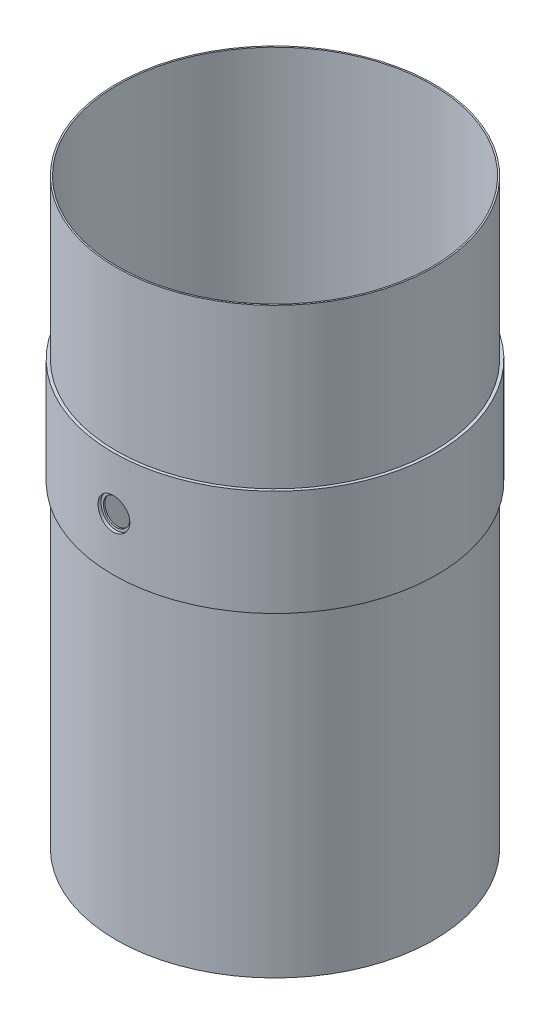
from build123d import *

# Parameters (mm, degrees)
BOSS_EXTRUDE1_DEPTH                  = 127
BOSS_EXTRUDE1_DEPTH_BACK             = 152.4
SKETCH1_R                            = 76.2
SKETCH1_R_2                          = 75.4888
SKETCH2_R                            = 77.6224
SKETCH2_R_2                          = 76.2
BOSS_EXTRUDE2_DEPTH                  = 50.8
F_1_2_0_5_DIAMETER_HOLE2_REACH       = 232.98
F_1_2_0_5_DIAMETER_HOLE2_BORE_R      = 6.35
F_1_2_START                          = 75.818042607
F_1_2_0_6_DIAMETER_HOLE1_OUTLINE_R   = 7.62
F_1_2_0_6_DIAMETER_HOLE1_OUTLINE_R_2 = 6.35
F_1_2_0_6_DIAMETER_HOLE1_DEPTH       = 3.181957393
F_1_2_START_2                        = 17
F_1_2_0_6_DIAMETER_HOLE1_2_DEPTH     = 17
F_1_2_START_3                        = 75.818042657
F_1_2_0_6_DIAMETER_HOLE1_3_OUTLINE_R = 6.35
F_1_2_0_6_DIAMETER_HOLE1_3_DEPTH     = 1.181957343


with BuildPart() as part:
    # Sketch1 → Boss-Extrude1 (new, two sides: drawn at the far end of the back side and taken through both)
    with BuildSketch(Plane(origin=(0, 0, 0), x_dir=(1, 0, 0), z_dir=(0, 1, 0)).offset(-BOSS_EXTRUDE1_DEPTH_BACK)):
        with Locations(Location((0, 0, 0), (0, 0, 270))):
            Circle(SKETCH1_R)
        with Locations(Location((0, 0, 0), (0, 0, 270))):
            Circle(SKETCH1_R_2, mode=Mode.SUBTRACT)
    extrude(amount=BOSS_EXTRUDE1_DEPTH + BOSS_EXTRUDE1_DEPTH_BACK)

    # Sketch2 → Boss-Extrude2 (add)
    with BuildSketch(Plane(origin=(0, 0, 0), x_dir=(1, 0, 0), z_dir=(0, 1, 0))):
        with Locations(Location((0, 0, 0), (0, 0, 270))):
            Circle(SKETCH2_R)
        with Locations(Location((0, 0, 0), (0, 0, 270))):
            Circle(SKETCH2_R_2, mode=Mode.SUBTRACT)
    extrude(amount=BOSS_EXTRUDE2_DEPTH)

    # 1/2 (0.5) Diameter Hole2 bore → 1/2 (0.5) Diameter Hole2 (cut, up to next)
    with BuildSketch(Plane.XY.offset(77.6224), mode=Mode.PRIVATE) as f_1_2_0_5_diameter_hole2_sk1:
        with Locations((0, 25.4)):
            Circle(F_1_2_0_5_DIAMETER_HOLE2_BORE_R)
    f_1_2_0_5_diameter_hole2_tool1 = extrude(f_1_2_0_5_diameter_hole2_sk1.sketch, amount=-F_1_2_0_5_DIAMETER_HOLE2_REACH, mode=Mode.PRIVATE) & part.part
    add(f_1_2_0_5_diameter_hole2_tool1.solids().sort_by_distance((0, 25.4, 77.6224))[0], mode=Mode.SUBTRACT)

    # 1/2 (0.6) Diameter Hole1: read off the stored shape, not the designer's step
    # 1/2 (0.6) Diameter Hole1 outline → 1/2 (0.6) Diameter Hole1 (cut)
    with BuildSketch(Plane.XY.offset(F_1_2_START)):
        with Locations((0, 25.4)):
            Circle(F_1_2_0_6_DIAMETER_HOLE1_OUTLINE_R)
        with Locations((0, 25.4)):
            Circle(F_1_2_0_6_DIAMETER_HOLE1_OUTLINE_R_2, mode=Mode.SUBTRACT)
    extrude(amount=F_1_2_0_6_DIAMETER_HOLE1_DEPTH, mode=Mode.SUBTRACT)

    # 1_2 _0.6_ Diameter Hole1 2 outline → 1_2 _0.6_ Diameter Hole1 2 (add)
    with BuildSketch(Plane(origin=(0, 0, 0), x_dir=(1, 0, 0), z_dir=(0, 1, 0)).offset(F_1_2_START_2)):
        with BuildLine():
            Line((7.620000605, -75.818042647), (-7.62000001, -75.818042706))
            ThreePointArc((-7.62000001, -75.818042706), (2.99e-07, -76.2), (7.620000605, -75.818042647))
        make_face()
    extrude(amount=F_1_2_0_6_DIAMETER_HOLE1_2_DEPTH)

    # 1_2 _0.6_ Diameter Hole1 3 outline → 1_2 _0.6_ Diameter Hole1 3 (cut)
    with BuildSketch(Plane.XY.offset(F_1_2_START_3)):
        with Locations((0, 25.4)):
            Circle(F_1_2_0_6_DIAMETER_HOLE1_3_OUTLINE_R)
    extrude(amount=F_1_2_0_6_DIAMETER_HOLE1_3_DEPTH, mode=Mode.SUBTRACT)


solid = part.part
